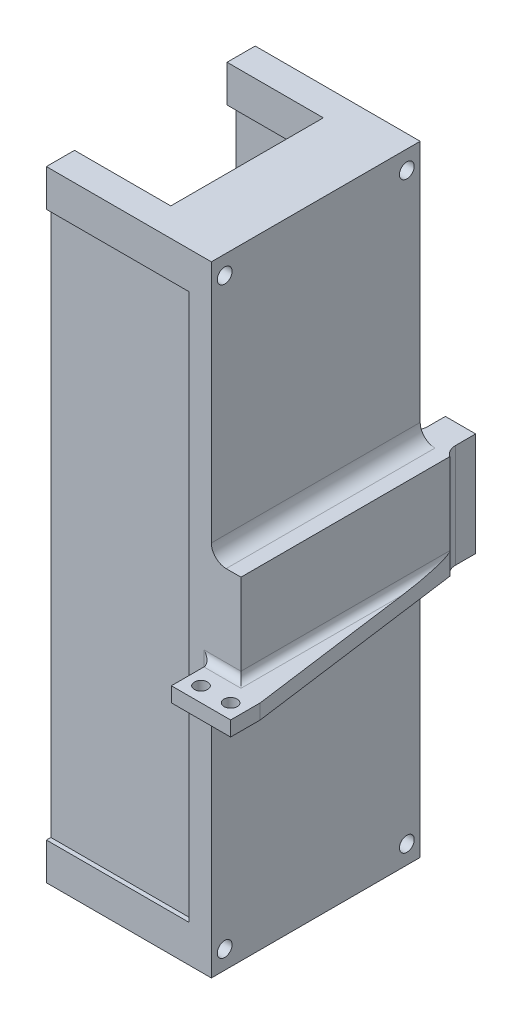
from build123d import *

# Parameters (mm, degrees)
SKETCH1_R           = 1.1303
BOSS_EXTRUDE1_DEPTH = 2.54
SKETCH2_W           = 5.08
SKETCH2_H           = 35.814
BOSS_EXTRUDE2_DEPTH = 15.24
SKETCH3_W           = 35.814
SKETCH3_H           = 106.370628
BOSS_EXTRUDE3_DEPTH = 3.81
FILLET1_R           = 1.27
SKETCH4_W           = 5.191
SKETCH4_H           = 17.78
BOSS_EXTRUDE4_DEPTH = 5.588
SKETCH5_W           = 35.814
SKETCH5_H           = 6.35
BOSS_EXTRUDE5_DEPTH = 7.9756
SKETCH6_W           = 4.826
SKETCH6_H           = 6.35
BOSS_EXTRUDE6_DEPTH = 16.51
BOSS_EXTRUDE8_START = -0.762
SKETCH7_W           = 24.4856
SKETCH7_H           = 93.670628
BOSS_EXTRUDE8_DEPTH = 2.54
FILLET2_R           = 2.54
SKETCH8_R           = 1.27
CUT_EXTRUDE1_DEPTH  = 87.153909833


with BuildPart() as part:
    # Sketch1 → Boss-Extrude1 (new body)
    with BuildSketch(Plane(origin=(0, 0, 0), x_dir=(1, 0, 0), z_dir=(0, 1, 0))):
        Polygon((-2.54, 2.54), (-2.54, 40.132), (2.54, 40.132), (7.62, 2.54), (7.62, -2.54), (-2.54, -2.54), align=None)
        with Locations(Location((0, 0, 0), (0, 0, 270))):
            Circle(SKETCH1_R, mode=Mode.SUBTRACT)
        with Locations(Location((5.08, 0, 0), (0, 0, 270))):
            Circle(SKETCH1_R, mode=Mode.SUBTRACT)
    extrude(amount=BOSS_EXTRUDE1_DEPTH)

    # Sketch2 → Boss-Extrude2 (add)
    with BuildSketch(Plane(origin=(0, 2.54, 0), x_dir=(1, 0, 0), z_dir=(0, 1, 0))):
        with Locations((0, 22.225)):
            Rectangle(SKETCH2_W, SKETCH2_H)
    extrude(amount=BOSS_EXTRUDE2_DEPTH)

    # Sketch3 → Boss-Extrude3 (add)
    with BuildSketch(Plane.ZY.offset(2.54)):
        with Locations((-22.225, 8.89)):
            Rectangle(SKETCH3_W, SKETCH3_H)
    extrude(amount=BOSS_EXTRUDE3_DEPTH)

    # Fillet1
    fillet1_edges = [part.edges().sort_by_distance(p)[0] for p in [
        (0, 2.54, -4.318),
        (2.54, 2.54, -22.225),
        (-2.54, 1.27, -4.318),
    ]]
    fillet(fillet1_edges, radius=FILLET1_R)

    # Sketch4 → Boss-Extrude4 (add)
    with BuildSketch(Plane(origin=(0, 0, -40.132), x_dir=(-1, 0, 0), z_dir=(0, 0, -1))):
        with Locations((1.2145, 8.89)):
            Rectangle(SKETCH4_W, SKETCH4_H)
    extrude(amount=BOSS_EXTRUDE4_DEPTH)

    # Sketch5 → Boss-Extrude5 (add)
    with BuildSketch(Plane.ZY.offset(6.35)):
        with Locations((-22.225, -41.120314)):
            Rectangle(SKETCH5_W, SKETCH5_H)
        with Locations((-22.225, 58.900314)):
            Rectangle(SKETCH5_W, SKETCH5_H)
    extrude(amount=BOSS_EXTRUDE5_DEPTH)

    # Sketch6 → Boss-Extrude6 (add)
    with BuildSketch(Plane.ZY.offset(14.3256)):
        with Locations((-37.719, 58.900314)):
            Rectangle(SKETCH6_W, SKETCH6_H)
        with Locations((-6.731, 58.900314)):
            Rectangle(SKETCH6_W, SKETCH6_H)
        with Locations((-37.719, -41.120314)):
            Rectangle(SKETCH6_W, SKETCH6_H)
        with Locations((-6.731, -41.120314)):
            Rectangle(SKETCH6_W, SKETCH6_H)
    extrude(amount=BOSS_EXTRUDE6_DEPTH)

    # Sketch7 → Boss-Extrude8 (add)
    with BuildSketch(Plane.XY.offset(-4.318).offset(BOSS_EXTRUDE8_START)):
        with Locations((-18.5928, 8.89)):
            Rectangle(SKETCH7_W, SKETCH7_H)
    boss_extrude8 = extrude(amount=-BOSS_EXTRUDE8_DEPTH)

    # Mirror2: Boss-Extrude8 across plane
    add(boss_extrude8.mirror(Plane.XY.offset(-22.225)))

    # Fillet2
    # the kernel refuses this fillet: 2.54 mm, written as the material it adds along each edge
    with BuildSketch(Plane(origin=(-6.35, -37.945314, -1.27), x_dir=(-1, 0, 0), z_dir=(0, 0, -1))) as fillet2_piece_1_section:
        with BuildLine():
            CenterArc((FILLET2_R, FILLET2_R), FILLET2_R, 180, 90)
            Line((0, FILLET2_R), (0, 0))
            Line((0, 0), (FILLET2_R, 0))
        make_face()
    fillet2_piece_1 = extrude(amount=35.56, mode=Mode.PRIVATE)
    fillet2_piece_1 = split(fillet2_piece_1, bisect_by=Plane(origin=(-6.917354565, -37.377959435, -5.08), z_dir=(0, 0, -1)), keep=Keep.TOP, mode=Mode.PRIVATE)
    add(fillet2_piece_1)
    with BuildSketch(Plane(origin=(-6.35, 55.725314, -36.83), x_dir=(-1, 0, 0), z_dir=(0, 0, 1))) as fillet2_piece_2_section:
        with BuildLine():
            CenterArc((FILLET2_R, FILLET2_R), FILLET2_R, 180, 90)
            Line((0, FILLET2_R), (0, 0))
            Line((0, 0), (FILLET2_R, 0))
        make_face()
    fillet2_piece_2 = extrude(amount=35.56, mode=Mode.PRIVATE)
    fillet2_piece_2 = split(fillet2_piece_2, bisect_by=Plane(origin=(-6.917354565, 55.157959435, -5.08), z_dir=(0, 0, -1)), keep=Keep.TOP, mode=Mode.PRIVATE)
    add(fillet2_piece_2)
    with BuildSketch(Plane(origin=(-2.54, 17.78, -4.318), x_dir=(1, 0, 0), z_dir=(0, 0, -1)), Plane(origin=(-2.54, 0, -40.132), x_dir=(1, 0, 0), z_dir=(0, 0, 1))) as fillet2_piece_3:
        with BuildLine():
            CenterArc((FILLET2_R, -FILLET2_R), FILLET2_R, 90, 90)
            Line((0, -FILLET2_R), (0, 0))
            Line((0, 0), (FILLET2_R, 0))
        make_face()
    extrude(amount=35.814)
    with BuildSketch(Plane(origin=(1.381, 0, -40.132), x_dir=(0, 0, -1), z_dir=(0, 1, 0))) as fillet2_piece_4:
        with BuildLine():
            CenterArc((2.131768984, -2.54), FILLET2_R, 90, 57.064075369)
            Line((0, -1.159), (0, 0))
            Line((0, 0), (2.131768984, 0))
        make_face()
    extrude(amount=3.810000082)
    with BuildSketch(Plane(origin=(1.381, 3.810000082, -40.132), x_dir=(0, 0, -1), z_dir=(0, 1, 0))) as fillet2_piece_5:
        with BuildLine():
            CenterArc((2.131768984, -2.54), FILLET2_R, 90, 57.064075369)
            Line((0, -1.159), (0, 0))
            Line((0, 0), (2.131768984, 0))
        make_face()
    extrude(amount=13.969999918)
    with BuildSketch(Plane(origin=(-3.81, 17.78, -40.132), x_dir=(-1, 0, 0), z_dir=(0, -1, 0))) as fillet2_piece_6:
        with BuildLine():
            CenterArc((FILLET2_R, FILLET2_R), FILLET2_R, 180, 90)
            Line((0, FILLET2_R), (0, 0))
            Line((0, 0), (FILLET2_R, 0))
        make_face()
    extrude(amount=17.78)

    # Sketch8 → Cut-Extrude1 (cut, through all)
    with BuildSketch(Plane.ZY.offset(30.8356)):
        with Locations((-37.846, 58.900314)):
            Circle(SKETCH8_R)
        with Locations((-6.604, 58.900314)):
            Circle(SKETCH8_R)
        with Locations((-37.846, -41.120314)):
            Circle(SKETCH8_R)
        with Locations((-6.604, -41.120314)):
            Circle(SKETCH8_R)
    extrude(amount=-CUT_EXTRUDE1_DEPTH, mode=Mode.SUBTRACT)


solid = part.part
